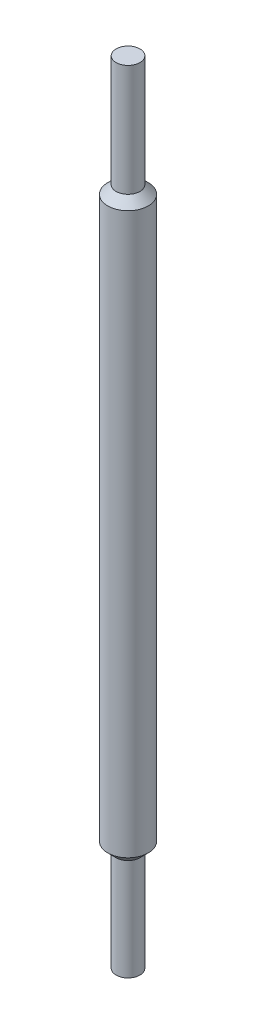
from build123d import *

# Parameters (mm, degrees)
SKETCH1_R           = 6.35
BOSS_EXTRUDE1_DEPTH = 421.64
SKETCH2_R           = 10.795
BOSS_EXTRUDE2_DEPTH = 421.64
SKETCH3_R           = 25.4
SKETCH3_R_2         = 6.35
CUT_EXTRUDE1_DEPTH  = 52.324
CUT_EXTRUDE2_START  = -57.658
SKETCH4_R           = 25.4
SKETCH4_R_2         = 6.35
CUT_EXTRUDE2_DEPTH  = 57.658
CHAMFER1_SIZE       = 6.35


with BuildPart() as part:
    # Sketch1 → Boss-Extrude1 (new body)
    with BuildSketch(Plane(origin=(0, 0, 0), x_dir=(1, 0, 0), z_dir=(0, 1, 0))):
        with Locations(Location((0, 0, 0), (0, 0, 270))):
            Circle(SKETCH1_R)
    extrude(amount=BOSS_EXTRUDE1_DEPTH)

    # Sketch2 → Boss-Extrude2 (add)
    with BuildSketch(Plane(origin=(0, 0, 0), x_dir=(-1, 0, 0), z_dir=(0, -1, 0))):
        with Locations(Location((0, 0, 0), (0, 0, 90))):
            Circle(SKETCH2_R)
    extrude(amount=-BOSS_EXTRUDE2_DEPTH)

    # Sketch3 → Cut-Extrude1 (cut)
    with BuildSketch(Plane.XZ):
        Circle(SKETCH3_R)
        with Locations(Location((0, 0, 0), (0, 0, 270))):
            Circle(SKETCH3_R_2, mode=Mode.SUBTRACT)
    extrude(amount=-CUT_EXTRUDE1_DEPTH, mode=Mode.SUBTRACT)

    # Sketch4 → Cut-Extrude2 (cut)
    with BuildSketch(Plane(origin=(0, 421.64, 0), x_dir=(1, 0, 0), z_dir=(0, 1, 0)).offset(CUT_EXTRUDE2_START)):
        Circle(SKETCH4_R)
        with Locations(Location((0, 0, 0), (0, 0, 90))):
            Circle(SKETCH4_R_2, mode=Mode.SUBTRACT)
    extrude(amount=CUT_EXTRUDE2_DEPTH, mode=Mode.SUBTRACT)

    # Chamfer1
    # the kernel refuses this chamfer: 6.35 mm, written as the material it takes off along each edge
    with BuildSketch(Plane(origin=(0, 52.324, 0), x_dir=(0, 0, -1), z_dir=(-1, 0, 0))) as chamfer1_piece_1_section:
        Polygon((10.795, -CHAMFER1_SIZE), (10.795 - CHAMFER1_SIZE, 0), (10.795, 0), align=None)
    chamfer1_piece_1 = revolve(axis=Axis((0, 52.324, 0), (0, -1, 0)), mode=Mode.PRIVATE)
    chamfer1_piece_1 = chamfer1_piece_1 - Plane(origin=(0, 56.4676015, 0), x_dir=(0, 0, -1), z_dir=(0, -1, 0)) * Cylinder(6.35, 44, mode=Mode.PRIVATE)
    add(chamfer1_piece_1, mode=Mode.SUBTRACT)
    with BuildSketch(Plane(origin=(0, 363.982, 0), x_dir=(0, 0, -1), z_dir=(-1, 0, 0))) as chamfer1_piece_2_section:
        Polygon((10.795, CHAMFER1_SIZE), (10.795 - CHAMFER1_SIZE, 0), (10.795, 0), align=None)
    chamfer1_piece_2 = revolve(axis=Axis((0, 363.982, 0), (0, -1, 0)), mode=Mode.PRIVATE)
    chamfer1_piece_2 = chamfer1_piece_2 - Plane(origin=(0, 359.8383985, 0), x_dir=(0, 0, -1), z_dir=(0, -1, 0)) * Cylinder(6.35, 44, mode=Mode.PRIVATE)
    add(chamfer1_piece_2, mode=Mode.SUBTRACT)


solid = part.part
